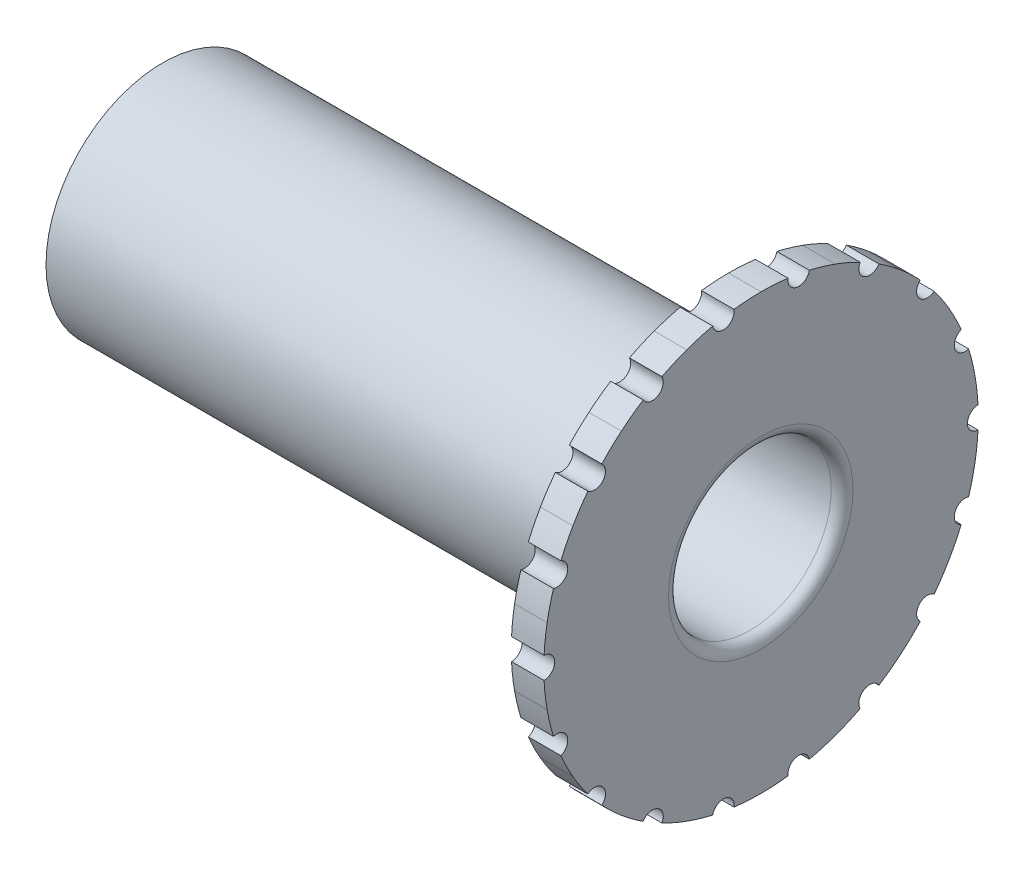
from build123d import *

# Parameters (mm, degrees)
SKETCH1_R           = 10.75
BOSS_EXTRUDE2_DEPTH = 52.14
SKETCH2_R           = 20
BOSS_EXTRUDE3_DEPTH = 3
SKETCH3_R           = 1
CUT_EXTRUDE1_DEPTH  = 3
CIRPATTERN1_START   = 52.14
CIRPATTERN1_DEPTH   = 3
CIRPATTERN1_2_DEPTH = 3
SKETCH4_R           = 7.5
CUT_EXTRUDE2_DEPTH  = 62.986402598
FILLET2_R           = 1
FILLET4_R           = 1


# Read off the part's stored shape, not the designer's step: CirPattern1
with BuildPart() as part:
    # Sketch1 → Boss-Extrude2 (new body)
    with BuildSketch(Plane(origin=(0, 0, 0), x_dir=(0, 0, -1), z_dir=(1, 0, 0))):
        Circle(SKETCH1_R)
    extrude(amount=BOSS_EXTRUDE2_DEPTH)

    # Sketch2 → Boss-Extrude3 (add)
    with BuildSketch(Plane(origin=(52.14, 0, 0), x_dir=(0, 0, -1), z_dir=(1, 0, 0))):
        Circle(SKETCH2_R)
    extrude(amount=BOSS_EXTRUDE3_DEPTH)

    # Sketch3 → Cut-Extrude1 (cut)
    with BuildSketch(Plane(origin=(55.14, 0, 0), x_dir=(0, 0, -1), z_dir=(1, 0, 0))):
        with Locations((-20, 0)):
            Circle(SKETCH3_R)
    extrude(amount=-CUT_EXTRUDE1_DEPTH, mode=Mode.SUBTRACT)

    # CirPattern1 outline → CirPattern1 (cut)
    with BuildSketch(Plane.YZ.offset(CIRPATTERN1_START)):
        with BuildLine():
            ThreePointArc((5.900409052, 19.109818759), (6.506281956, 17.852840103), (7.778852675, 18.425239512))
            ThreePointArc((7.778852675, 18.425239512), (6.848190457, 18.791016137), (5.900409052, 19.109818759))
        make_face()
        with BuildLine():
            ThreePointArc((12.086414836, 15.934822761), (12.22794579, 14.549675416), (13.61678206, 14.648660223))
            ThreePointArc((13.61678206, 14.648660223), (12.867677964, 15.310874038), (12.086414836, 15.934822761))
        make_face()
        with BuildLine():
            ThreePointArc((16.810590801, 10.835314343), (16.47494628, 9.48879137), (17.808086245, 9.103409487))
            ThreePointArc((17.808086245, 9.103409487), (17.330985942, 9.981829806), (16.810590801, 10.835314343))
        make_face()
        with BuildLine():
            ThreePointArc((19.503391106, 4.429191278), (18.735007106, 3.280463458), (19.847989696, 2.461159283))
            ThreePointArc((19.847989696, 2.461159283), (19.700281222, 3.449481086), (19.503391106, 4.429191278))
        make_face()
        with BuildLine():
            ThreePointArc((19.84201465, -2.50887517), (18.735421034, -3.32658451), (19.492870417, -4.475265679))
            ThreePointArc((19.492870417, -4.475265679), (19.692002659, -3.49643122), (19.84201465, -2.50887517))
        make_face()
        with BuildLine():
            ThreePointArc((17.788419504, -9.141779453), (16.475994384, -9.535444558), (16.788488823, -10.869528189))
            ThreePointArc((16.788488823, -10.869528189), (17.310023867, -10.018137238), (17.788419504, -9.141779453))
        make_face()
        with BuildLine():
            ThreePointArc((13.592634413, -14.671069822), (12.229137651, -14.597143884), (12.063064753, -15.952506661))
            ThreePointArc((12.063064753, -15.952506661), (12.843840743, -15.330875871), (13.592634413, -14.671069822))
        make_face()
        with BuildLine():
            ThreePointArc((7.761531719, -18.432542564), (6.507059889, -17.901025517), (5.886728013, -19.114037598))
            ThreePointArc((5.886728013, -19.114037598), (6.832631799, -18.796679034), (7.761531719, -18.432542564))
        make_face()
        with BuildLine():
            ThreePointArc((0.997306295, -19.975119027), (0, -19.048468559), (-0.997306295, -19.975119027))
            ThreePointArc((-0.997306295, -19.975119027), (0, -20), (0.997306295, -19.975119027))
        make_face()
        with BuildLine():
            ThreePointArc((-5.886728013, -19.114037598), (-6.507059889, -17.901025517), (-7.761531719, -18.432542564))
            ThreePointArc((-7.761531719, -18.432542564), (-6.832631799, -18.796679034), (-5.886728013, -19.114037598))
        make_face()
        with BuildLine():
            ThreePointArc((-12.063064753, -15.952506661), (-12.229137651, -14.597143884), (-13.592634413, -14.671069822))
            ThreePointArc((-13.592634413, -14.671069822), (-12.843840743, -15.330875871), (-12.063064753, -15.952506661))
        make_face()
        with BuildLine():
            ThreePointArc((-16.788488823, -10.869528189), (-16.475994384, -9.535444558), (-17.788419504, -9.141779453))
            ThreePointArc((-17.788419504, -9.141779453), (-17.310023867, -10.018137238), (-16.788488823, -10.869528189))
        make_face()
        with BuildLine():
            ThreePointArc((-19.492870417, -4.475265679), (-18.735421034, -3.32658451), (-19.84201465, -2.50887517))
            ThreePointArc((-19.84201465, -2.50887517), (-19.692002659, -3.49643122), (-19.492870417, -4.475265679))
        make_face()
        with BuildLine():
            ThreePointArc((-19.847989696, 2.461159283), (-18.735007106, 3.280463458), (-19.503391106, 4.429191278))
            ThreePointArc((-19.503391106, 4.429191278), (-19.700281222, 3.449481086), (-19.847989696, 2.461159283))
        make_face()
        with BuildLine():
            ThreePointArc((-17.808086245, 9.103409487), (-16.47494628, 9.48879137), (-16.810590801, 10.835314343))
            ThreePointArc((-16.810590801, 10.835314343), (-17.330985942, 9.981829806), (-17.808086245, 9.103409487))
        make_face()
        with BuildLine():
            ThreePointArc((-13.61678206, 14.648660223), (-12.22794579, 14.549675416), (-12.086414836, 15.934822761))
            ThreePointArc((-12.086414836, 15.934822761), (-12.867677964, 15.310874038), (-13.61678206, 14.648660223))
        make_face()
        with BuildLine():
            ThreePointArc((-7.778852675, 18.425239512), (-6.506281956, 17.852840103), (-5.900409052, 19.109818759))
            ThreePointArc((-5.900409052, 19.109818759), (-6.848190457, 18.791016137), (-7.778852675, 18.425239512))
        make_face()
    extrude(amount=CIRPATTERN1_DEPTH, mode=Mode.SUBTRACT)

    # CirPattern1 2 outline → CirPattern1 2 (add)
    with BuildSketch(Plane.YZ.offset(CIRPATTERN1_START)):
        with BuildLine():
            ThreePointArc((3.477107782, 19.695423871), (4.697891956, 19.440416949), (5.900409052, 19.109818759))
            ThreePointArc((5.900409052, 19.109818759), (5.900575423, 19.110315343), (5.900742054, 19.11081184))
            ThreePointArc((5.900742054, 19.11081184), (4.6980433, 19.44092006), (3.477107782, 19.695423871))
        make_face()
        with BuildLine():
            ThreePointArc((7.778852675, 18.425239512), (10.010382471, 17.314509603), (12.086414836, 15.934822761))
            ThreePointArc((12.086414836, 15.934822761), (12.087932565, 15.936740596), (12.089454981, 15.938654714))
            ThreePointArc((12.089454981, 15.938654714), (11.072191499, 16.660202173), (10.011932832, 17.316942067))
            ThreePointArc((10.011932832, 17.316942067), (8.913050067, 17.90678306), (7.779539896, 18.426985349))
            ThreePointArc((7.779539896, 18.426985349), (7.779196695, 18.426112269), (7.778852675, 18.425239512))
        make_face()
        with BuildLine():
            ThreePointArc((13.61678206, 14.648660223), (15.332698931, 12.841664358), (16.810590801, 10.835314343))
            ThreePointArc((16.810590801, 10.835314343), (16.815287954, 10.838238984), (16.820001217, 10.841137589))
            ThreePointArc((16.820001217, 10.841137589), (16.110869994, 11.867095014), (15.339171021, 12.846858467))
            ThreePointArc((15.339171021, 12.846858467), (14.508296497, 13.776967737), (13.621065015, 14.6534813))
            ThreePointArc((13.621065015, 14.6534813), (13.618927424, 14.651067309), (13.61678206, 14.648660223))
        make_face()
        with BuildLine():
            ThreePointArc((17.808086245, 9.103409487), (18.801560161, 6.819188772), (19.503391106, 4.429191278))
            ThreePointArc((19.503391106, 4.429191278), (19.512589898, 4.431187106), (19.521807069, 4.43309626))
            ThreePointArc((19.521807069, 4.43309626), (19.206339797, 5.639718044), (18.816278804, 6.824331125))
            ThreePointArc((18.816278804, 6.824331125), (18.35362825, 7.982523766), (17.819688668, 9.109628132))
            ThreePointArc((17.819688668, 9.109628132), (17.813897689, 9.106499718), (17.808086245, 9.103409487))
        make_face()
        with BuildLine():
            ThreePointArc((19.847989696, 2.461159283), (19.999985547, -0.024044267), (19.84201465, -2.50887517))
            ThreePointArc((19.84201465, -2.50887517), (19.855517324, -2.510628199), (19.868994877, -2.512564914))
            ThreePointArc((19.868994877, -2.512564914), (19.985241565, -1.270815167), (20.023865664, -0.02423428))
            ThreePointArc((20.023865664, -0.02423428), (19.985241565, 1.222346607), (19.868994877, 2.464096355))
            ThreePointArc((19.868994877, 2.464096355), (19.858500074, 2.462572129), (19.847989696, 2.461159283))
        make_face()
        with BuildLine():
            ThreePointArc((19.492870417, -4.475265679), (18.786104765, -6.86165197), (17.788419504, -9.141779453))
            ThreePointArc((17.788419504, -9.141779453), (17.804126031, -9.149800201), (17.819688668, -9.158096691))
            ThreePointArc((17.819688668, -9.158096691), (18.35362825, -8.030992325), (18.816278804, -6.872799684))
            ThreePointArc((18.816278804, -6.872799684), (19.206339797, -5.688186603), (19.521807069, -4.481564819))
            ThreePointArc((19.521807069, -4.481564819), (19.507315424, -4.478522373), (19.492870417, -4.475265679))
        make_face()
        with BuildLine():
            ThreePointArc((16.788488823, -10.869528189), (15.309019954, -12.869883761), (13.592634413, -14.671069822))
            ThreePointArc((13.592634413, -14.671069822), (13.607011755, -14.686360653), (13.621065015, -14.701949859))
            ThreePointArc((13.621065015, -14.701949859), (14.508296497, -13.825436296), (15.339171021, -12.895327026))
            ThreePointArc((15.339171021, -12.895327026), (16.110869994, -11.915563573), (16.820001217, -10.889606148))
            ThreePointArc((16.820001217, -10.889606148), (16.804151235, -10.879714364), (16.788488823, -10.869528189))
        make_face()
        with BuildLine():
            ThreePointArc((12.063064753, -15.952506661), (9.989559592, -17.326531654), (7.761531719, -18.432542564))
            ThreePointArc((7.761531719, -18.432542564), (7.770785461, -18.453893466), (7.779539896, -18.475453908))
            ThreePointArc((7.779539896, -18.475453908), (8.913050067, -17.955251619), (10.011932832, -17.365410626))
            ThreePointArc((10.011932832, -17.365410626), (11.072191499, -16.708670732), (12.089454981, -15.987123273))
            ThreePointArc((12.089454981, -15.987123273), (12.076071493, -15.969958576), (12.063064753, -15.952506661))
        make_face()
        with BuildLine():
            ThreePointArc((5.886728013, -19.114037598), (3.468839488, -19.696881799), (0.997306295, -19.975119027))
            ThreePointArc((0.997306295, -19.975119027), (0.99878948, -19.999279383), (0.999687451, -20.023468559))
            ThreePointArc((0.999687451, -20.023468559), (2.242758256, -19.922321618), (3.477107782, -19.74389243))
            ThreePointArc((3.477107782, -19.74389243), (4.6980433, -19.489388619), (5.900742054, -19.159280399))
            ThreePointArc((5.900742054, -19.159280399), (5.893467138, -19.13674198), (5.886728013, -19.114037598))
        make_face()
        with BuildLine():
            ThreePointArc((-0.997306295, -19.975119027), (-3.468839488, -19.696881799), (-5.886728013, -19.114037598))
            ThreePointArc((-5.886728013, -19.114037598), (-5.893467138, -19.13674198), (-5.900742054, -19.159280399))
            ThreePointArc((-5.900742054, -19.159280399), (-4.6980433, -19.489388619), (-3.477107782, -19.74389243))
            ThreePointArc((-3.477107782, -19.74389243), (-2.242758256, -19.922321618), (-0.999687451, -20.023468559))
            ThreePointArc((-0.999687451, -20.023468559), (-0.99878948, -19.999279383), (-0.997306295, -19.975119027))
        make_face()
        with BuildLine():
            ThreePointArc((-7.761531719, -18.432542564), (-9.989559592, -17.326531654), (-12.063064753, -15.952506661))
            ThreePointArc((-12.063064753, -15.952506661), (-12.076071493, -15.969958576), (-12.089454981, -15.987123273))
            ThreePointArc((-12.089454981, -15.987123273), (-11.072191499, -16.708670732), (-10.011932832, -17.365410626))
            ThreePointArc((-10.011932832, -17.365410626), (-8.913050067, -17.955251619), (-7.779539896, -18.475453908))
            ThreePointArc((-7.779539896, -18.475453908), (-7.770785461, -18.453893466), (-7.761531719, -18.432542564))
        make_face()
        with BuildLine():
            ThreePointArc((-13.592634413, -14.671069822), (-15.309019954, -12.869883761), (-16.788488823, -10.869528189))
            ThreePointArc((-16.788488823, -10.869528189), (-16.804151235, -10.879714364), (-16.820001217, -10.889606148))
            ThreePointArc((-16.820001217, -10.889606148), (-16.110869994, -11.915563573), (-15.339171021, -12.895327026))
            ThreePointArc((-15.339171021, -12.895327026), (-14.508296497, -13.825436296), (-13.621065015, -14.701949859))
            ThreePointArc((-13.621065015, -14.701949859), (-13.607011755, -14.686360653), (-13.592634413, -14.671069822))
        make_face()
        with BuildLine():
            ThreePointArc((-17.788419504, -9.141779453), (-18.786104765, -6.86165197), (-19.492870417, -4.475265679))
            ThreePointArc((-19.492870417, -4.475265679), (-19.507315424, -4.478522373), (-19.521807069, -4.481564819))
            ThreePointArc((-19.521807069, -4.481564819), (-19.206339797, -5.688186603), (-18.816278804, -6.872799684))
            ThreePointArc((-18.816278804, -6.872799684), (-18.35362825, -8.030992325), (-17.819688668, -9.158096691))
            ThreePointArc((-17.819688668, -9.158096691), (-17.804126031, -9.149800201), (-17.788419504, -9.141779453))
        make_face()
        with BuildLine():
            ThreePointArc((-19.84201465, -2.50887517), (-19.999985547, -0.024044267), (-19.847989696, 2.461159283))
            ThreePointArc((-19.847989696, 2.461159283), (-19.858500074, 2.462572129), (-19.868994877, 2.464096355))
            ThreePointArc((-19.868994877, 2.464096355), (-19.985241565, 1.222346607), (-20.023865664, -0.02423428))
            ThreePointArc((-20.023865664, -0.02423428), (-19.985241565, -1.270815167), (-19.868994877, -2.512564914))
            ThreePointArc((-19.868994877, -2.512564914), (-19.855517324, -2.510628199), (-19.84201465, -2.50887517))
        make_face()
        with BuildLine():
            ThreePointArc((-19.503391106, 4.429191278), (-18.801560161, 6.819188772), (-17.808086245, 9.103409487))
            ThreePointArc((-17.808086245, 9.103409487), (-17.813897689, 9.106499718), (-17.819688668, 9.109628132))
            ThreePointArc((-17.819688668, 9.109628132), (-18.35362825, 7.982523766), (-18.816278804, 6.824331125))
            ThreePointArc((-18.816278804, 6.824331125), (-19.206339797, 5.639718044), (-19.521807069, 4.43309626))
            ThreePointArc((-19.521807069, 4.43309626), (-19.512589898, 4.431187106), (-19.503391106, 4.429191278))
        make_face()
        with BuildLine():
            ThreePointArc((-16.810590801, 10.835314343), (-15.332698931, 12.841664358), (-13.61678206, 14.648660223))
            ThreePointArc((-13.61678206, 14.648660223), (-13.618927424, 14.651067309), (-13.621065015, 14.6534813))
            ThreePointArc((-13.621065015, 14.6534813), (-14.508296497, 13.776967737), (-15.339171021, 12.846858467))
            ThreePointArc((-15.339171021, 12.846858467), (-16.110869994, 11.867095014), (-16.820001217, 10.841137589))
            ThreePointArc((-16.820001217, 10.841137589), (-16.815287954, 10.838238984), (-16.810590801, 10.835314343))
        make_face()
        with BuildLine():
            ThreePointArc((-12.086414836, 15.934822761), (-10.010382471, 17.314509603), (-7.778852675, 18.425239512))
            ThreePointArc((-7.778852675, 18.425239512), (-7.779196695, 18.426112269), (-7.779539896, 18.426985349))
            ThreePointArc((-7.779539896, 18.426985349), (-8.913050067, 17.90678306), (-10.011932832, 17.316942067))
            ThreePointArc((-10.011932832, 17.316942067), (-11.072191499, 16.660202173), (-12.089454981, 15.938654714))
            ThreePointArc((-12.089454981, 15.938654714), (-12.087932565, 15.936740596), (-12.086414836, 15.934822761))
        make_face()
        with BuildLine():
            ThreePointArc((-3.477107782, 19.695423871), (-4.6980433, 19.44092006), (-5.900742054, 19.11081184))
            ThreePointArc((-5.900742054, 19.11081184), (-5.900575423, 19.110315343), (-5.900409052, 19.109818759))
            ThreePointArc((-5.900409052, 19.109818759), (-4.697891956, 19.440416949), (-3.477107782, 19.695423871))
        make_face()
    extrude(amount=CIRPATTERN1_2_DEPTH)

    # Sketch4 → Cut-Extrude2 (cut, through all)
    with BuildSketch(Plane.ZY):
        Circle(SKETCH4_R)
    extrude(amount=-CUT_EXTRUDE2_DEPTH, mode=Mode.SUBTRACT)

    # Fillet2
    fillet2_edges = [part.edges().sort_by_distance(p)[0] for p in [
        (55.14, 0, -7.5),
    ]]
    fillet(fillet2_edges, radius=FILLET2_R)

    # Fillet4
    fillet4_edges = [part.edges().sort_by_distance(p)[0] for p in [
        (0, 0, -7.5),
    ]]
    fillet(fillet4_edges, radius=FILLET4_R)


solid = part.part
